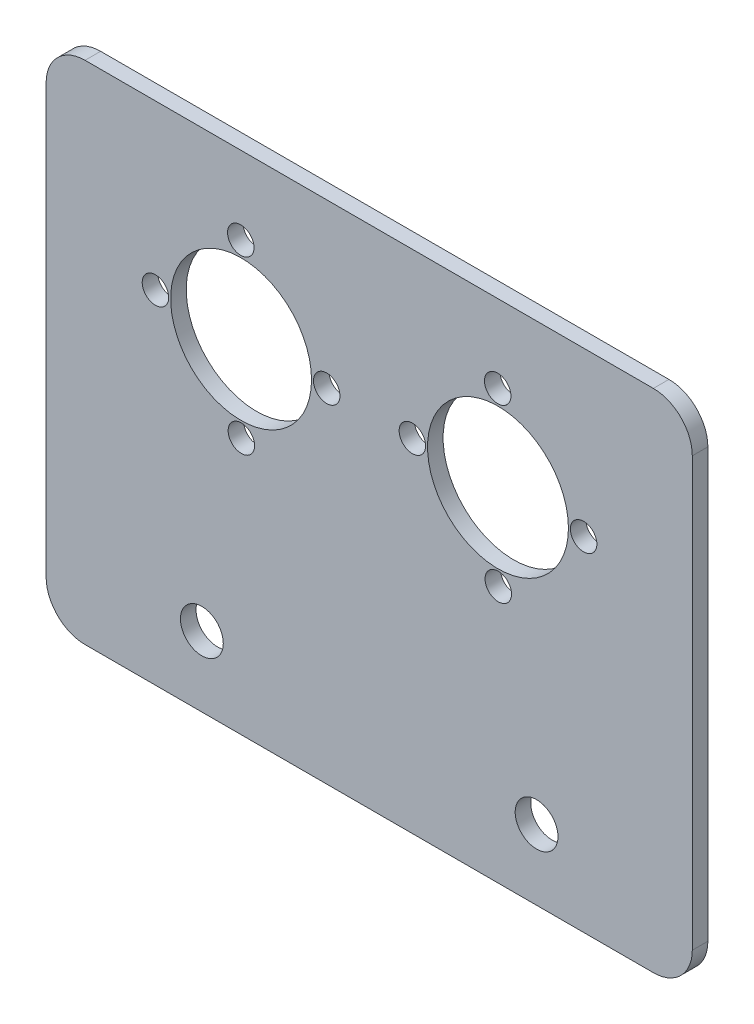
from build123d import *

# Parameters (mm, degrees)
SKETCH1_W               = 83
SKETCH1_H               = 65
BASE_FLANGE1_DEPTH      = 2
SKETCH6_R               = 9.05
CUT_EXTRUDE1_DEPTH      = 12
M3_CLEARANCE_HOLE1_D    = 3.4
LPATTERN1_COUNT         = 2
LPATTERN1_PITCH         = 33
FILLET1_R               = 5
FLAT_PATTERN1_START     = -2
FLAT_PATTERN1_OUTLINE_R = 2.75
FLAT_PATTERN1_DEPTH     = 2


# Read off the part's stored shape, not the designer's step: Flat-Pattern1
# Sheet-metal steps are written as plain solids
with BuildPart() as part:
    # Sketch1 → Base-Flange1 (new body)
    with BuildSketch(Plane.XY):
        Rectangle(SKETCH1_W, SKETCH1_H)
    extrude(amount=-BASE_FLANGE1_DEPTH)

    # Sketch6 → Cut-Extrude1 (cut)
    with BuildSketch(Plane.XY):
        with Locations((16.541079456, 11.5)):
            Circle(SKETCH6_R)
        with Locations((-16.458920544, 11.5)):
            Circle(SKETCH6_R)
    extrude(amount=-CUT_EXTRUDE1_DEPTH, mode=Mode.SUBTRACT)

    # M3 Clearance Hole1 (through all)
    with Locations(Plane.XY):
        with Locations((16.50520677, 22.499941507), (27.541020963, 11.535872686), (5.541137949, 11.464127314), (16.576952141, 0.500058493)):
            m3_clearance_hole1 = Hole(M3_CLEARANCE_HOLE1_D / 2)

    # LPattern1: M3 Clearance Hole1 ×2
    with Locations(*[(-i * LPATTERN1_PITCH, 0, 0) for i in range(1, LPATTERN1_COUNT)]):
        add(m3_clearance_hole1, mode=Mode.SUBTRACT)

    # Fillet1
    fillet1_edges = [part.edges().sort_by_distance(p)[0] for p in [
        (41.5, -32.5, -1),
        (-41.5, -32.5, -1),
        (-41.5, 32.5, -1),
        (41.5, 32.5, -1),
    ]]
    fillet(fillet1_edges, radius=FILLET1_R)

    # Flat-Pattern1 outline → Flat-Pattern1 (cut)
    with BuildSketch(Plane.XY.offset(FLAT_PATTERN1_START)):
        with Locations((-21.496938457, -23.5)):
            Circle(FLAT_PATTERN1_OUTLINE_R)
        with Locations((21.5, -23.5)):
            Circle(FLAT_PATTERN1_OUTLINE_R)
    extrude(amount=FLAT_PATTERN1_DEPTH, mode=Mode.SUBTRACT)


solid = part.part
